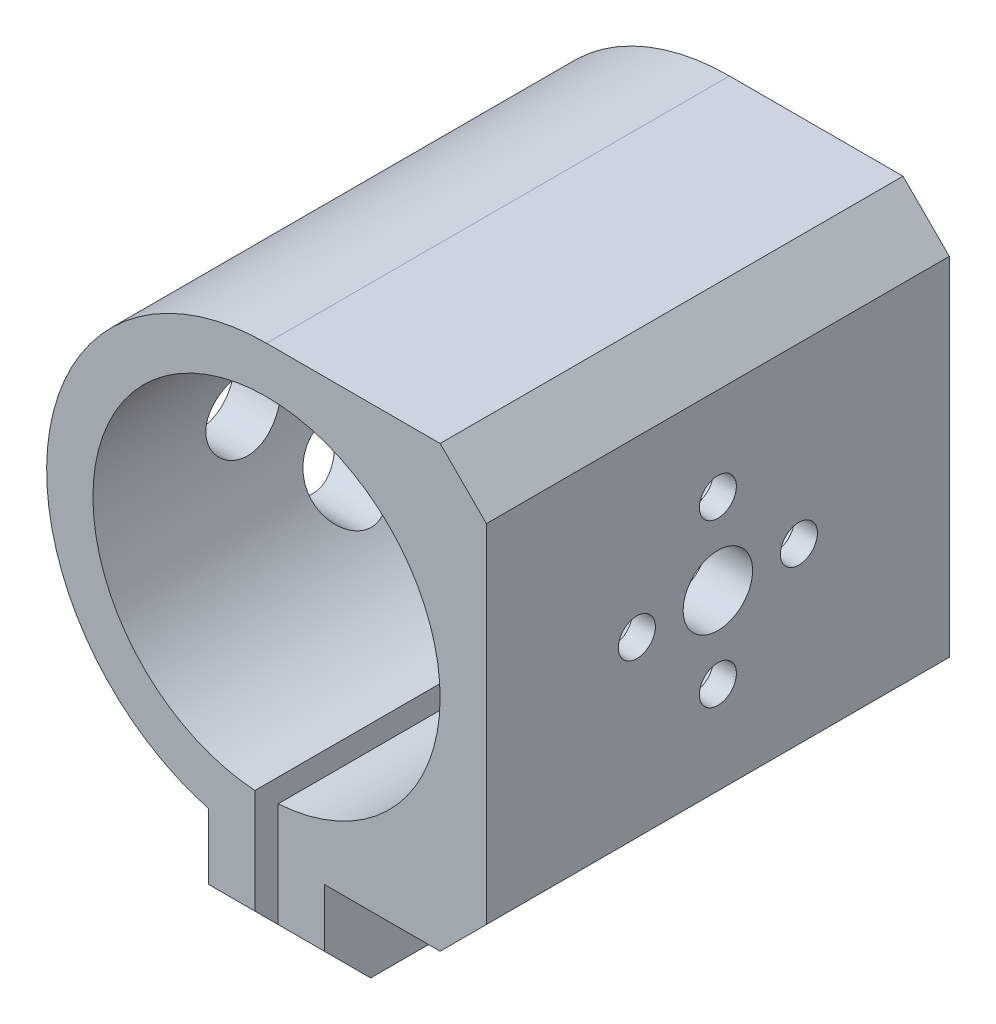
from build123d import *

# Parameters (mm, degrees)
EXTRUDE_1_DEPTH          = 40
SKETCH_2_W               = 10
SKETCH_2_H               = 28
EXTRUDE_2_DEPTH          = 15
CUT_EXTRUDE_1_REACH      = 54.393
SKETCH_3_R               = 15
SKETCH_4_W               = 14
SKETCH_4_H               = 4
CUT_EXTRUDE_2_DEPTH      = 20
CUT_EXTRUDE_3_REACH      = 54.393
SKETCH_5_W               = 2
SKETCH_5_H               = 30
SKETCH_6_R               = 11
CUT_EXTRUDE_4_DEPTH      = 20
SKETCH_7_R               = 3
CUT_EXTRUDE_5_DEPTH      = 62.870833319
SKETCH_14_R              = 1.6
CUT_EXTRUDE_6_DEPTH      = 10
SKETCH_15_R              = 3.25
CUT_EXTRUDE_7_DEPTH      = 61.663003678
PATTERN_CIRCULAR_1_COUNT = 4
CHAMFER_1_SIZE           = 4
SKETCH_16_R              = 2.25
CUT_EXTRUDE_8_DEPTH      = 55.405882153
SKETCH_17_W              = 22
SKETCH_17_H              = 12.4
CUT_EXTRUDE_10_DEPTH     = 10


with BuildPart() as part:
    # 草圖1 → 填料-伸長1 (new body)
    with BuildSketch(Plane.XY):
        with BuildLine():
            Line((0, 19), (19, 19))
            Line((19, 19), (19, -19))
            Line((19, -19), (0, -19))
            ThreePointArc((0, -19), (-19, 0), (0, 19))
        make_face()
    extrude(amount=EXTRUDE_1_DEPTH)

    # 草圖2 → 填料-伸長2 (add)
    with BuildSketch(Plane.XY.offset(40)):
        with Locations((0, -14)):
            Rectangle(SKETCH_2_W, SKETCH_2_H)
    extrude(amount=-EXTRUDE_2_DEPTH)

    # 草圖3 → 除料-伸長1 (cut, up to next)
    with BuildSketch(Plane.XY.offset(40), mode=Mode.PRIVATE) as cut_extrude_1_sk1:
        Circle(SKETCH_3_R)
    cut_extrude_1_tool1 = extrude(cut_extrude_1_sk1.sketch, amount=-CUT_EXTRUDE_1_REACH, mode=Mode.PRIVATE) & part.part
    add(cut_extrude_1_tool1.solids().sort_by_distance((0, 0, 40))[0], mode=Mode.SUBTRACT)

    # 草圖4 → 除料-伸長2 (cut)
    with BuildSketch(Plane(origin=(0, 0, 0), x_dir=(-1, 0, 0), z_dir=(0, 0, -1))):
        with Locations((0, 14)):
            Rectangle(SKETCH_4_W, SKETCH_4_H)
    extrude(amount=-CUT_EXTRUDE_2_DEPTH, mode=Mode.SUBTRACT)

    # 草圖5 → 除料-伸長3 (cut, up to next)
    with BuildSketch(Plane(origin=(0, 0, 0), x_dir=(-1, 0, 0), z_dir=(0, 0, -1)), mode=Mode.PRIVATE) as cut_extrude_3_sk1:
        with Locations((0, -15)):
            Rectangle(SKETCH_5_W, SKETCH_5_H)
    cut_extrude_3_tool1 = extrude(cut_extrude_3_sk1.sketch, amount=-CUT_EXTRUDE_3_REACH, mode=Mode.PRIVATE) & part.part
    add(cut_extrude_3_tool1.solids().sort_by_distance((0, -15, 0))[0], mode=Mode.SUBTRACT)

    # 草圖6 → 除料-伸長4 (cut)
    with BuildSketch(Plane(origin=(0, -19, 0), x_dir=(-1, 0, 0), z_dir=(0, -1, 0))):
        with Locations((0, -6)):
            Circle(SKETCH_6_R)
    extrude(amount=-CUT_EXTRUDE_4_DEPTH, mode=Mode.SUBTRACT)

    # 草圖7 → 除料-伸長5 (cut, through all)
    with BuildSketch(Plane(origin=(19, 0, 0), x_dir=(0, 0, -1), z_dir=(1, 0, 0))):
        with Locations((-20, 0)):
            Circle(SKETCH_7_R)
    extrude(amount=-CUT_EXTRUDE_5_DEPTH, mode=Mode.SUBTRACT)

    # 草圖14 → 除料-伸長6 (cut)
    with BuildSketch(Plane(origin=(19, 0, 0), x_dir=(0, 0, -1), z_dir=(1, 0, 0))):
        with Locations((-20, 7)):
            Circle(SKETCH_14_R)
    cut_extrude_6 = extrude(amount=-CUT_EXTRUDE_6_DEPTH, mode=Mode.SUBTRACT)

    # 草圖15 → 除料-伸長7 (cut, through all)
    with BuildSketch(Plane(origin=(17, 0, 0), x_dir=(0, 0, -1), z_dir=(1, 0, 0))):
        with Locations((-20, 7)):
            Circle(SKETCH_15_R)
    cut_extrude_7 = extrude(amount=-CUT_EXTRUDE_7_DEPTH, mode=Mode.SUBTRACT)

    # 環狀複製排列1: 除料-伸長6, 除料-伸長7 ×4 about axis
    pattern_circular_1_axis = Axis((-19, 0, 20), (1, 0, 0))
    add([cut_extrude_6.rotate(pattern_circular_1_axis, i * 360 / PATTERN_CIRCULAR_1_COUNT) for i in range(1, PATTERN_CIRCULAR_1_COUNT)], mode=Mode.SUBTRACT)
    add([cut_extrude_7.rotate(pattern_circular_1_axis, i * 360 / PATTERN_CIRCULAR_1_COUNT) for i in range(1, PATTERN_CIRCULAR_1_COUNT)], mode=Mode.SUBTRACT)

    # 導角1
    chamfer_1_edges = [part.edges().sort_by_distance(p)[0] for p in [
        (19, -19, 20),
        (19, 19, 20),
        (3, -28, 25),
        (-3, -28, 25),
        (-3, -28, 40),
        (3, -28, 40),
    ]]
    chamfer(chamfer_1_edges, length=CHAMFER_1_SIZE)

    # 草圖16 → 除料-伸長8 (cut, through all)
    with BuildSketch(Plane.ZY.offset(5)):
        with Locations((32.5, -23)):
            Circle(SKETCH_16_R)
    extrude(amount=-CUT_EXTRUDE_8_DEPTH, mode=Mode.SUBTRACT)

    # 草圖17 → 除料-伸長10 (cut)
    with BuildSketch(Plane(origin=(0, -19, 0), x_dir=(-1, 0, 0), z_dir=(0, -1, 0))):
        Rectangle(SKETCH_17_W, SKETCH_17_H)
    extrude(amount=-CUT_EXTRUDE_10_DEPTH, mode=Mode.SUBTRACT)


solid = part.part
